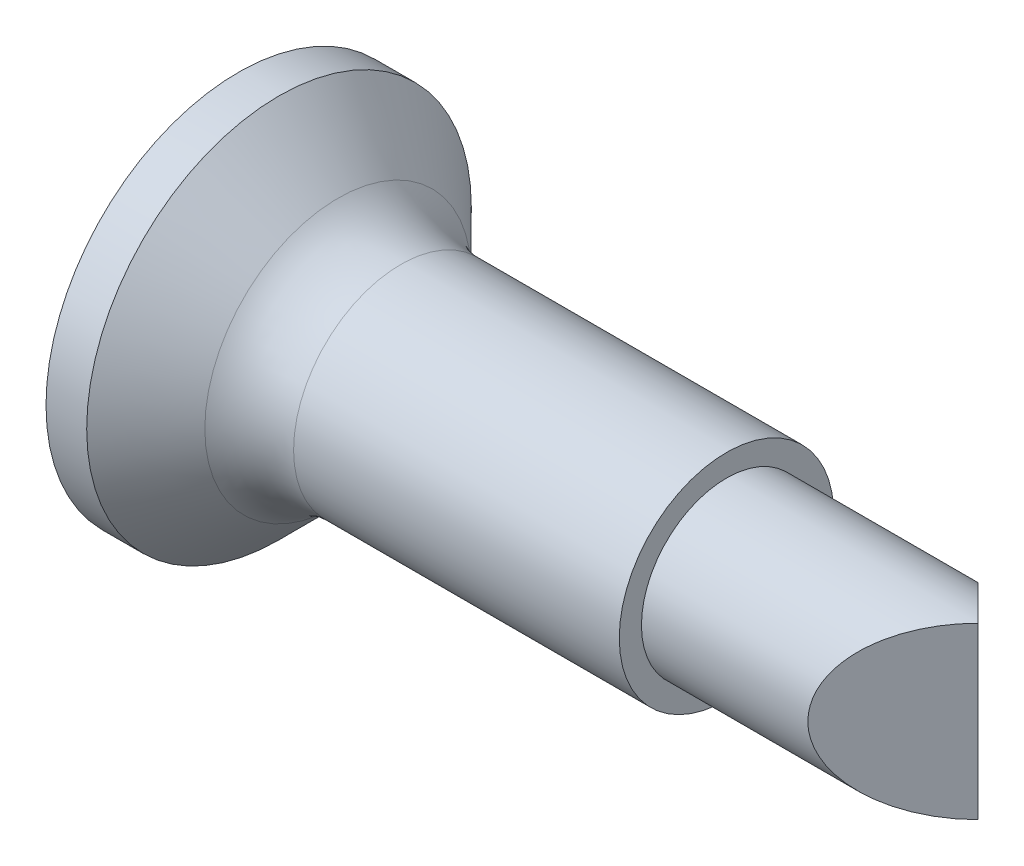
from build123d import *

# Parameters (mm, degrees)
CUT_EXTRUDE1_DEPTH      = 12.314150432
CUT_EXTRUDE1_DEPTH_BACK = 12.314150432
CROSSRECESS_DEPTH       = 0.85
FILLET1_R               = 1.2
FILLET2_R               = 0.34
DRAFT1_ANGLE            = -25


with BuildPart() as part:
    # Sketch1 → Base (revolve)
    with BuildSketch(Plane.XY):
        with BuildLine():
            Line((0.7, 2.6), (1.25, 2.6))
            Line((1.25, 2.6), (2.4, 1.45))
            Line((2.4, 1.45), (7.3, 1.45))
            Line((7.3, 1.45), (7.3, 1.15))
            Line((7.3, 1.15), (10.7, 1.15))
            Line((10.7, 1.15), (10.7, 0))
            Line((10.7, 0), (0, 0))
            ThreePointArc((0, 0), (0.178061251, 1.346291202), (0.7, 2.6))
        make_face()
    revolve(axis=Axis((-68.714227642, 0, 0), (1, 0, 0)))

    # Sketch2 → Cut-Extrude1 (cut, two sides: drawn at the far end of the back side and taken through both)
    with BuildSketch(Plane(origin=(0, 0, 0), x_dir=(1, 0, 0), z_dir=(0, 1, 0)).offset(-CUT_EXTRUDE1_DEPTH_BACK)):
        Polygon((10.7, 0), (-4.3, 15), (11.04657513, 15), (11.04657513, -15), (-4.3, -15), align=None)
    extrude(amount=CUT_EXTRUDE1_DEPTH + CUT_EXTRUDE1_DEPTH_BACK, mode=Mode.SUBTRACT)

    # Sketch3 → CrossRecess (cut)
    with BuildSketch(Plane(origin=(0, 0, 0), x_dir=(0, 0, -1), z_dir=(1, 0, 0))):
        Polygon((-0.34, 0.34), (-1.7, 0.34), (-1.7, -0.34), (-0.34, -0.34), (-0.34, -1.7), (0.34, -1.7), (0.34, -0.34), (1.7, -0.34), (1.7, 0.34), (0.34, 0.34), (0.34, 1.7), (-0.34, 1.7), align=None)
    extrude(amount=CROSSRECESS_DEPTH, mode=Mode.SUBTRACT)

    # Fillet1
    fillet1_edges = [part.edges().sort_by_distance(p)[0] for p in [
        (2.4, -1.45, 0),
    ]]
    fillet(fillet1_edges, radius=FILLET1_R)

    # Fillet2
    fillet2_edges = [part.edges().sort_by_distance(p)[0] for p in [
        (0.43618554, -0.34, -0.34),
        (0.43618554, -0.34, 0.34),
        (0.43618554, 0.34, 0.34),
        (0.43618554, 0.34, -0.34),
    ]]
    fillet(fillet2_edges, radius=FILLET2_R)

    # Draft1
    draft1_faces = [part.faces().sort_by_distance(p)[0] for p in [
        (0.57045298, 0, 1.7),
        (0.57045298, 1.7, 0),
        (0.57045298, -1.7, 0),
        (0.57045298, 0, -1.7),
    ]]
    draft(draft1_faces, Plane(origin=(0, 0, 0), x_dir=(0, 0, 1), z_dir=(1, 0, 0)), DRAFT1_ANGLE)


solid = part.part
